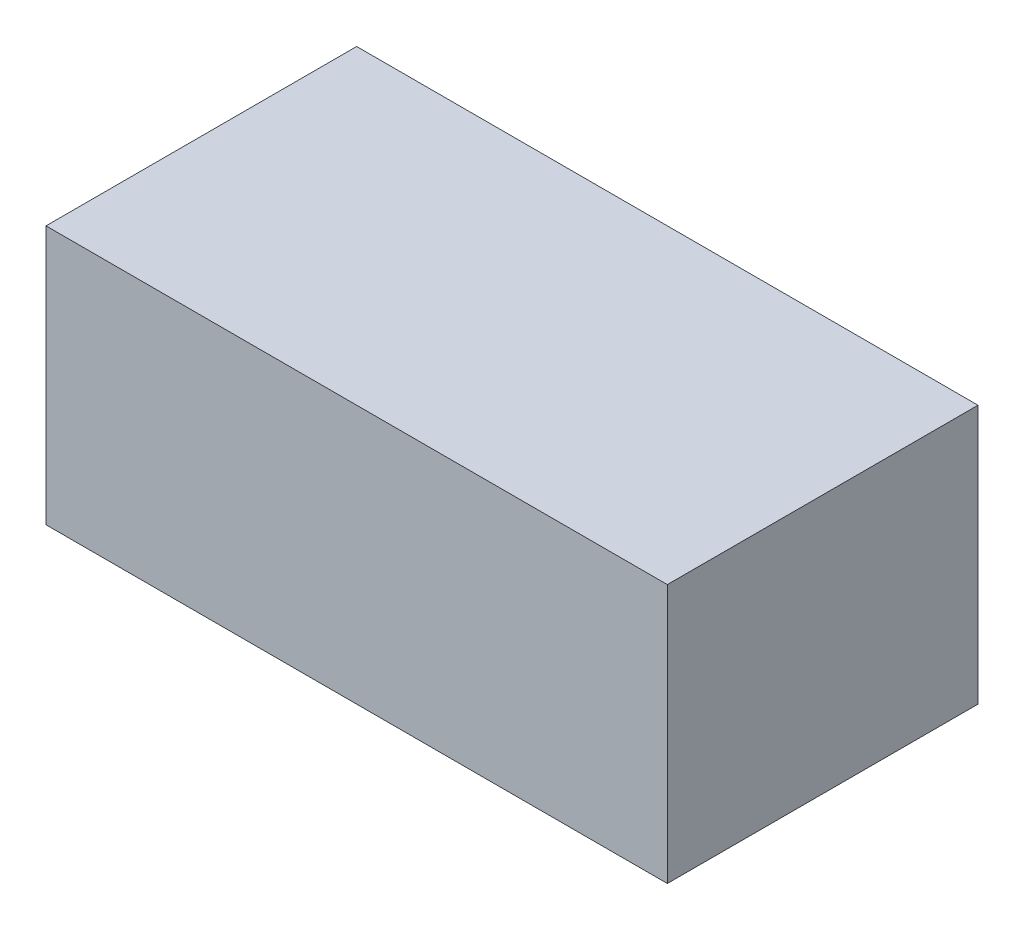
from build123d import *

# Parameters (mm, degrees)
SKETCH1_W           = 150
SKETCH1_H           = 125
BOSS_EXTRUDE1_DEPTH = 300


with BuildPart() as part:
    # Sketch1 → Boss-Extrude1 (new body)
    with BuildSketch(Plane(origin=(0, 0, 0), x_dir=(0, 0, -1), z_dir=(1, 0, 0))):
        with Locations((75, 62.5)):
            Rectangle(SKETCH1_W, SKETCH1_H)
    extrude(amount=BOSS_EXTRUDE1_DEPTH)


solid = part.part
